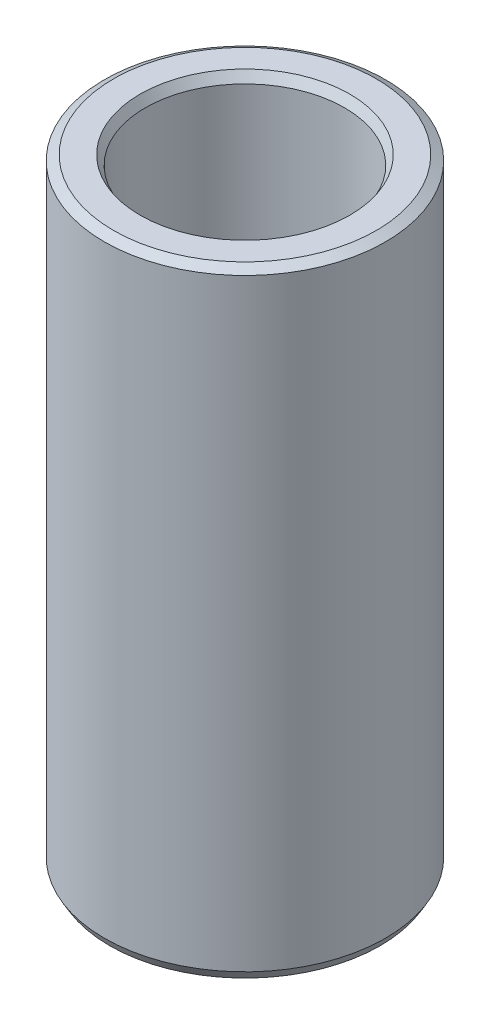
from build123d import *
from OCP.BRepFilletAPI import BRepFilletAPI_MakeChamfer

# Parameters (mm, degrees)
SKETCH1_R           = 30
BOSS_EXTRUDE1_DEPTH = 131.800180526
SKETCH2_R           = 21.261122872
CUT_EXTRUDE1_DEPTH  = 139.460418845
CHAMFER1_SIZE       = 1.129180472
CHAMFER1_SIZE2      = 1.955797948


with BuildPart() as part:
    # Sketch1 → Boss-Extrude1 (new body)
    with BuildSketch(Plane(origin=(0, 0, 0), x_dir=(1, 0, 0), z_dir=(0, 1, 0))):
        Circle(SKETCH1_R)
    extrude(amount=BOSS_EXTRUDE1_DEPTH)

    # Sketch2 → Cut-Extrude1 (cut, through all)
    with BuildSketch(Plane(origin=(0, 0, 0), x_dir=(1, 0, 0), z_dir=(0, 1, 0))):
        Circle(SKETCH2_R)
    extrude(amount=CUT_EXTRUDE1_DEPTH, mode=Mode.SUBTRACT)

    # Chamfer1: one chamfer whose edges measure the first distance from different faces: ONE call of the kernel's chamfer builder (chamfer() names one face for all edges)
    chamfer1_edges_1 = [part.edges().sort_by_distance(p)[0] for p in [
        (-21.261122872, 131.800180526, 0),
    ]]
    chamfer1_side_1 = [part.faces().sort_by_distance(p)[0] for p in [
        (-29.151471863, 131.800180526, 0),
    ]]
    chamfer1_edges_2 = [part.edges().sort_by_distance(p)[0] for p in [
        (-21.261122872, 0, 0),
    ]]
    chamfer1_side_2 = [part.faces().sort_by_distance(p)[0] for p in [
        (-21.261122872, 65.900090263, 0),
    ]]
    chamfer1_edges_3 = [part.edges().sort_by_distance(p)[0] for p in [
        (-30, 0, 0),
    ]]
    chamfer1_side_3 = [part.faces().sort_by_distance(p)[0] for p in [
        (-29.151471863, 0, 0),
    ]]
    chamfer1_edges_4 = [part.edges().sort_by_distance(p)[0] for p in [
        (-30, 131.800180526, 0),
    ]]
    chamfer1_side_4 = [part.faces().sort_by_distance(p)[0] for p in [
        (-30, 65.900090263, 0),
    ]]
    chamfer1 = BRepFilletAPI_MakeChamfer(part.part.solid().wrapped)
    for e in chamfer1_edges_1:
        chamfer1.Add(CHAMFER1_SIZE, CHAMFER1_SIZE2, e.wrapped, chamfer1_side_1[0].wrapped)  # the first distance lies on this face
    for e in chamfer1_edges_2:
        chamfer1.Add(CHAMFER1_SIZE, CHAMFER1_SIZE2, e.wrapped, chamfer1_side_2[0].wrapped)  # the first distance lies on this face
    for e in chamfer1_edges_3:
        chamfer1.Add(CHAMFER1_SIZE, CHAMFER1_SIZE2, e.wrapped, chamfer1_side_3[0].wrapped)  # the first distance lies on this face
    for e in chamfer1_edges_4:
        chamfer1.Add(CHAMFER1_SIZE, CHAMFER1_SIZE2, e.wrapped, chamfer1_side_4[0].wrapped)  # the first distance lies on this face
    add(Compound.cast(chamfer1.Shape()), mode=Mode.REPLACE)


solid = part.part
